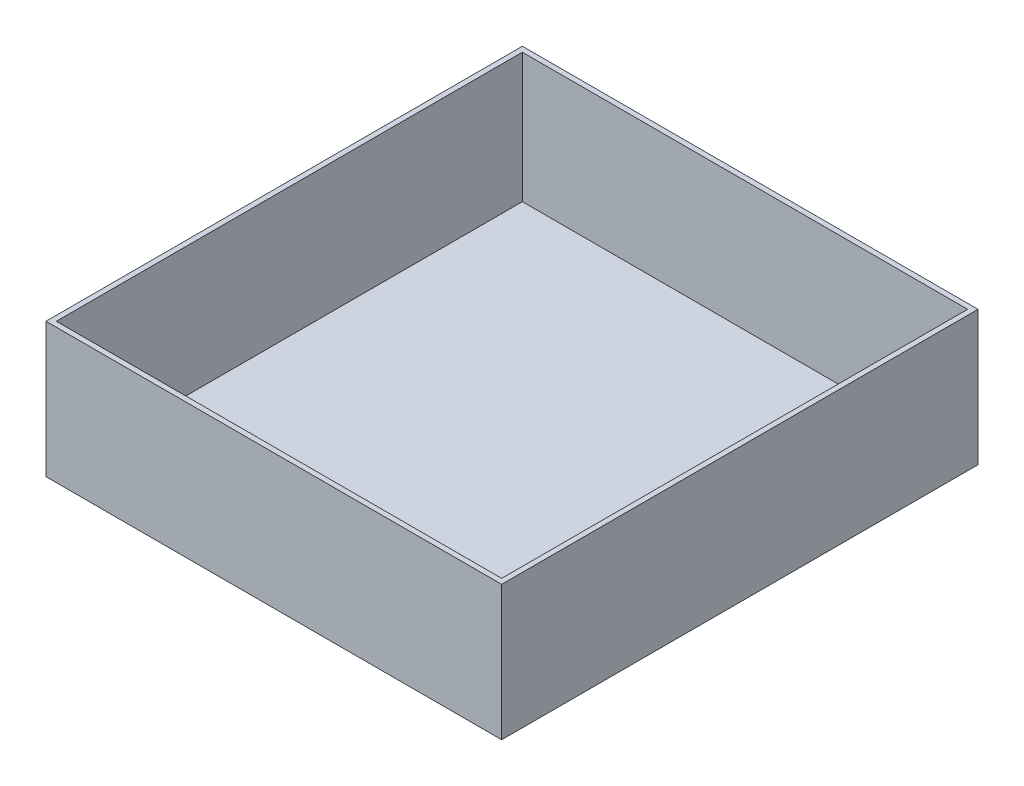
from build123d import *

# Parameters (mm, degrees)
SKETCH1_W           = 279.4
SKETCH1_H           = 292.1
BOSS_EXTRUDE1_DEPTH = 82.55
SKETCH3_W           = 273.05
SKETCH3_H           = 285.75
CUT_EXTRUDE1_DEPTH  = 79.375


with BuildPart() as part:
    # Sketch1 → Boss-Extrude1 (new body)
    with BuildSketch(Plane(origin=(0, 0, 0), x_dir=(1, 0, 0), z_dir=(0, 1, 0))):
        with Locations((139.7, 146.05)):
            Rectangle(SKETCH1_W, SKETCH1_H)
    extrude(amount=BOSS_EXTRUDE1_DEPTH)

    # Sketch3 → Cut-Extrude1 (cut)
    with BuildSketch(Plane(origin=(0, 82.55, 0), x_dir=(1, 0, 0), z_dir=(0, 1, 0))):
        with Locations((139.7, 146.05)):
            Rectangle(SKETCH3_W, SKETCH3_H)
    extrude(amount=-CUT_EXTRUDE1_DEPTH, mode=Mode.SUBTRACT)


solid = part.part
